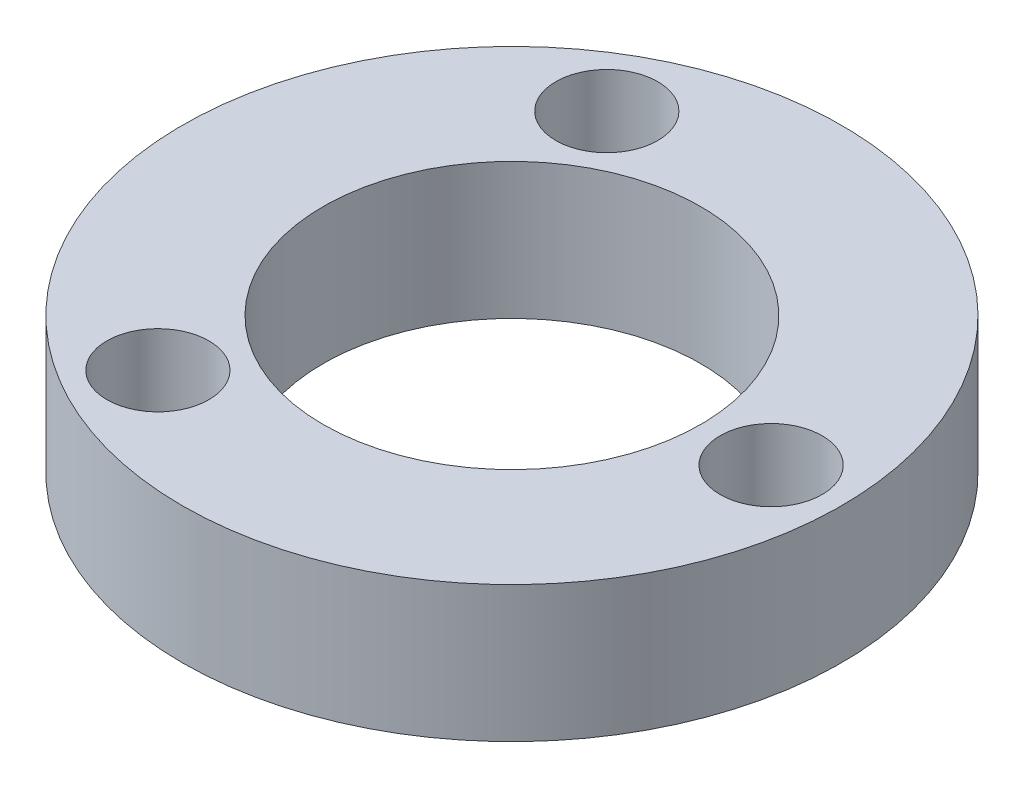
from build123d import *

# Parameters (mm, degrees)
SKETCH1_R           = 24.2275
SKETCH1_R_2         = 13.8775
BOSS_EXTRUDE1_DEPTH = 10
SKETCH3_R           = 3.75
CUT_EXTRUDE1_DEPTH  = 7.5
CIRPATTERN1_COUNT   = 3


with BuildPart() as part:
    # Sketch1 → Boss-Extrude1 (new body)
    with BuildSketch(Plane(origin=(0, 0, 0), x_dir=(1, 0, 0), z_dir=(0, 1, 0))):
        Circle(SKETCH1_R)
        Circle(SKETCH1_R_2, mode=Mode.SUBTRACT)
    extrude(amount=BOSS_EXTRUDE1_DEPTH)

    # Sketch3 → Cut-Extrude1 (cut)
    with BuildSketch(Plane(origin=(0, 10, 0), x_dir=(1, 0, 0), z_dir=(0, 1, 0))):
        with Locations((19.0525, 0)):
            Circle(SKETCH3_R)
    cut_extrude1 = extrude(amount=-CUT_EXTRUDE1_DEPTH, mode=Mode.SUBTRACT)

    # CirPattern1: Cut-Extrude1 ×3 about axis
    cirpattern1_axis = Axis((0, 0, 0), (0, 1, 0))
    for i in range(1, CIRPATTERN1_COUNT):
        add(cut_extrude1.rotate(cirpattern1_axis, i * 360 / CIRPATTERN1_COUNT), mode=Mode.SUBTRACT)


solid = part.part
